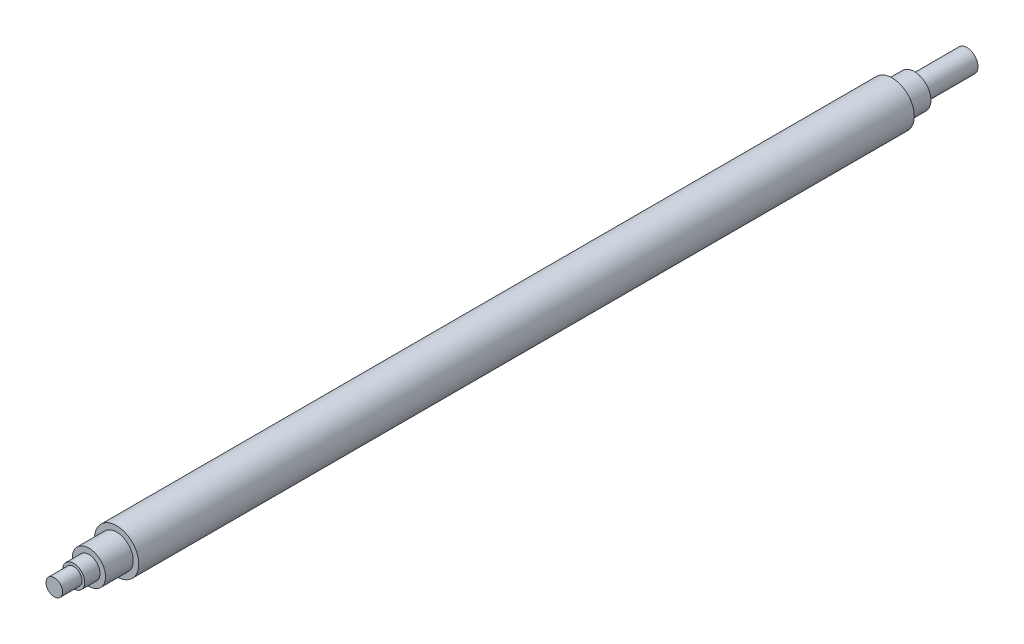
from build123d import *


with BuildPart() as part:
    # Schizzo2 → Rivoluzione2 (revolve)
    with BuildSketch(Plane(origin=(0, 0, 0), x_dir=(0, 0, -1), z_dir=(1, 0, 0))):
        Polygon((1.5, 0), (1.5, 3), (8.5, 3), (8.5, 4), (14, 4), (14, 6), (24, 6), (24, 8), (304, 8), (304, 6), (312, 6), (312, 4), (331, 4), (331, 0), align=None)
    revolve(axis=Axis((0, 0, 0), (0, 0, -1)))


solid = part.part
